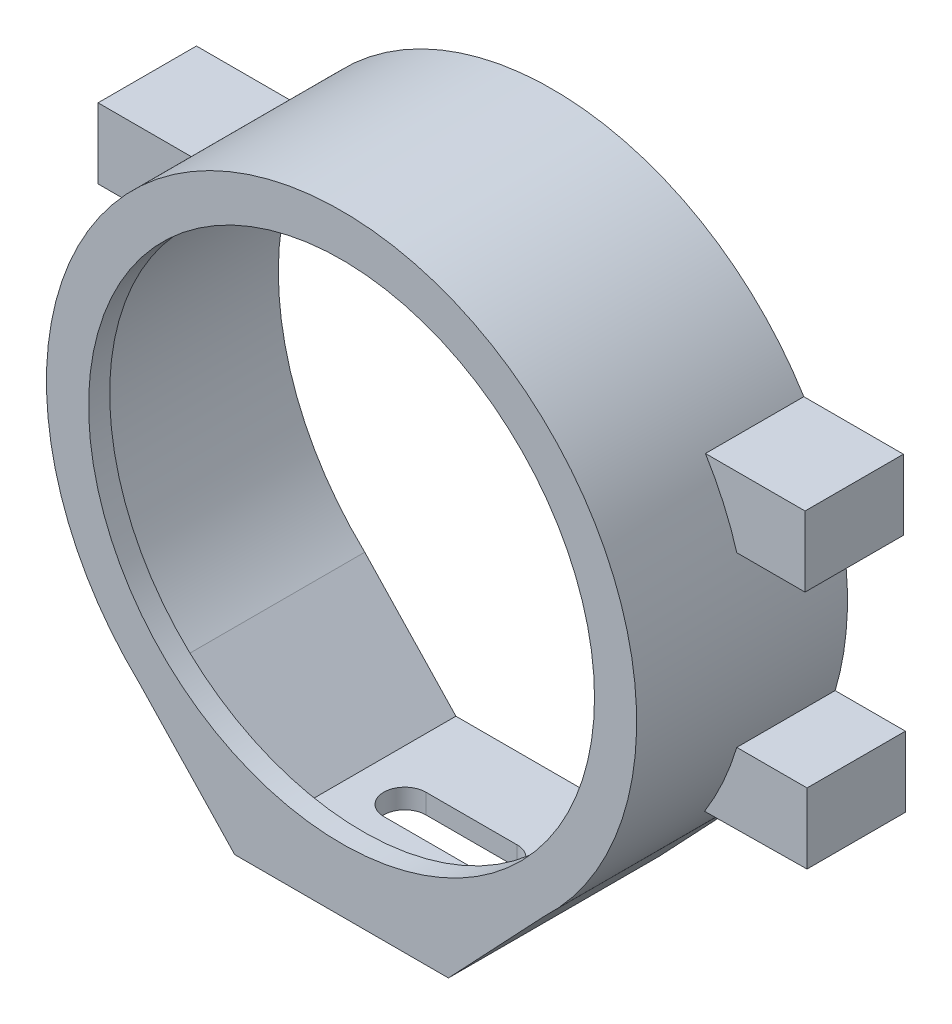
from build123d import *

# Parameters (mm, degrees)
BOSS_EXTRUDE1_DEPTH = 15
SHELL3_DEPTH        = 13.5
SKETCH5_R           = 18
CUT_EXTRUDE4_DEPTH  = 11
BOSS_EXTRUDE2_START = -8
BOSS_EXTRUDE2_DEPTH = 7
CUT_EXTRUDE5_REACH  = 54.505


# Read off the part's stored shape, not the designer's step: Shell3
with BuildPart() as part:
    # Sketch1 → Boss-Extrude1 (new body)
    with BuildSketch(Plane.XY):
        with BuildLine():
            Line((-7.603827524, -22.477243695), (7.603827524, -22.477243695))
            Line((7.603827524, -22.477243695), (14.409989224, -15.275870207))
            ThreePointArc((14.409989224, -15.275870207), (0, 21), (-14.409989224, -15.275870207))
            Line((-14.409989224, -15.275870207), (-7.603827524, -22.477243695))
        make_face()
    extrude(amount=BOSS_EXTRUDE1_DEPTH)

    # Shell3 outline → Shell3 (cut)
    with BuildSketch(Plane.XY):
        with BuildLine():
            Line((6.863063192, -21.077243695), (13.349946464, -14.213688101))
            ThreePointArc((13.349946464, -14.213688101), (0, 19.5), (-13.349946464, -14.213688101))
            Line((-13.349946464, -14.213688101), (-6.863063192, -21.077243695))
            Line((-6.863063192, -21.077243695), (6.863063192, -21.077243695))
        make_face()
    extrude(amount=SHELL3_DEPTH, mode=Mode.SUBTRACT)

    # Sketch5 → Cut-Extrude4 (cut)
    with BuildSketch(Plane.XY.offset(15)):
        Circle(SKETCH5_R)
    extrude(amount=-CUT_EXTRUDE4_DEPTH, mode=Mode.SUBTRACT)

    # Sketch6 → Boss-Extrude2 (add)
    with BuildSketch(Plane.XY.offset(15).offset(BOSS_EXTRUDE2_START)):
        Polygon((17.530464007, 10.991223826), (24.980464007, 10.991223826), (24.980464007, 5.991223826), (19.980464007, 5.991223826), align=None)
        Polygon((17.673562003, -11.090259794), (20.075985217, -6.005149393), (25.123075828, -6.005149393), (25.123075828, -11.005149393), align=None)
        Polygon((-17.877308509, 10.991223826), (-20.094018297, 5.991223826), (-25.327308509, 5.991223826), (-25.327308509, 10.991223826), align=None)
        Polygon((-25.294081514, -11.005149393), (-25.294081514, -6.005149393), (-20.094018297, -6.005149393), (-17.844081514, -11.005149393), align=None)
    extrude(amount=-BOSS_EXTRUDE2_DEPTH)

    # Sketch21 → Cut-Extrude5 (cut, up to next)
    with BuildSketch(Plane.XZ.offset(22.477243695), mode=Mode.PRIVATE) as cut_extrude5_sk1:
        with BuildLine():
            Line((-3.249172698, 8.75), (3.250827302, 8.75))
            ThreePointArc((3.250827302, 8.75), (4.750827302, 7.25), (3.250827302, 5.75))
            Line((3.250827302, 5.75), (-3.249172698, 5.75))
            ThreePointArc((-3.249172698, 5.75), (-4.749172698, 7.25), (-3.249172698, 8.75))
        make_face()
    cut_extrude5_tool1 = extrude(cut_extrude5_sk1.sketch, amount=-CUT_EXTRUDE5_REACH, mode=Mode.PRIVATE) & part.part
    add(cut_extrude5_tool1.solids().sort_by_distance((0.000827, -22.477244, 7.25))[0], mode=Mode.SUBTRACT)


solid = part.part
